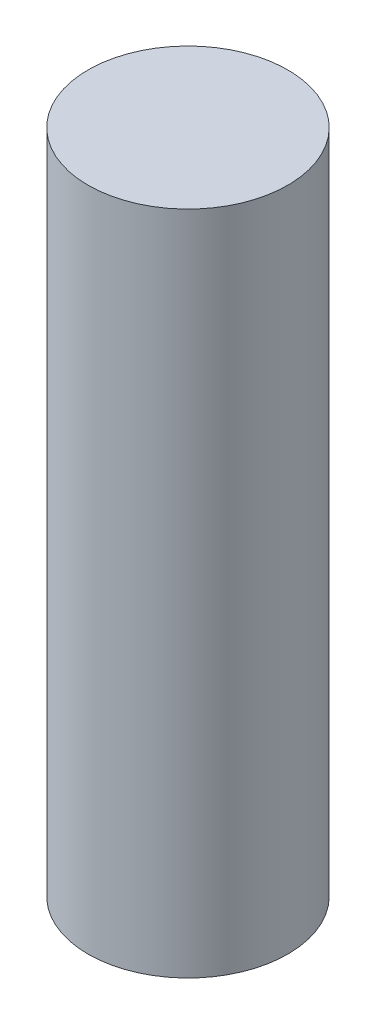
from build123d import *

# Parameters (mm, degrees)
SKETCH1_R           = 1.5
BOSS_EXTRUDE1_DEPTH = 10


with BuildPart() as part:
    # Sketch1 → Boss-Extrude1 (new body)
    with BuildSketch(Plane(origin=(0, 0, 0), x_dir=(1, 0, 0), z_dir=(0, 1, 0))):
        Circle(SKETCH1_R)
    extrude(amount=BOSS_EXTRUDE1_DEPTH)


solid = part.part
